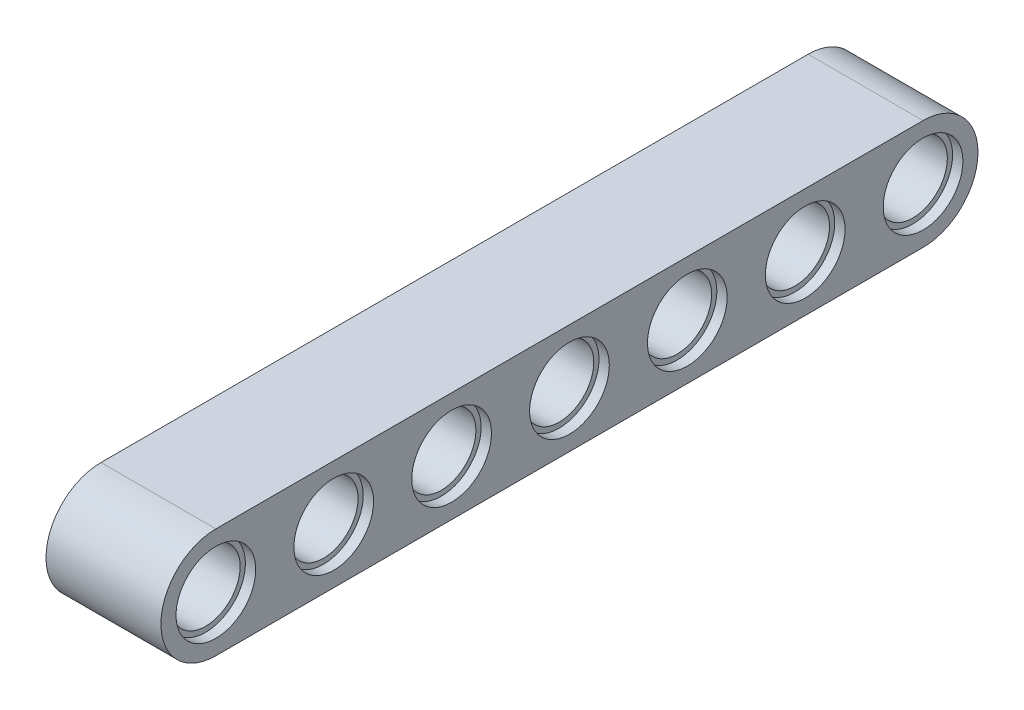
from build123d import *

# Parameters (mm, degrees)
SKETCH1_R           = 2.35
BOSS_EXTRUDE1_DEPTH = 7.8
SKETCH2_R           = 2.705
CUT_EXTRUDE2_DEPTH  = 0.7
CUT_EXTRUDE3_START  = -0.7
SKETCH3_R           = 2.705
CUT_EXTRUDE3_DEPTH  = 0.7


with BuildPart() as part:
    # Sketch1 → Boss-Extrude1 (new body)
    with BuildSketch(Plane(origin=(0, 0, 0), x_dir=(0, 0, -1), z_dir=(1, 0, 0))):
        with BuildLine():
            Line((-24, -3.73), (24, -3.73))
            ThreePointArc((24, -3.73), (27.73, 0), (24, 3.73))
            Line((24, 3.73), (-24, 3.73))
            ThreePointArc((-24, 3.73), (-27.73, 0), (-24, -3.73))
        make_face()
        with Locations((-24, 0)):
            Circle(SKETCH1_R, mode=Mode.SUBTRACT)
        with Locations((-16, 0)):
            Circle(SKETCH1_R, mode=Mode.SUBTRACT)
        with Locations((-8, 0)):
            Circle(SKETCH1_R, mode=Mode.SUBTRACT)
        Circle(SKETCH1_R, mode=Mode.SUBTRACT)
        with Locations((8, 0)):
            Circle(SKETCH1_R, mode=Mode.SUBTRACT)
        with Locations((16, 0)):
            Circle(SKETCH1_R, mode=Mode.SUBTRACT)
        with Locations((24, 0)):
            Circle(SKETCH1_R, mode=Mode.SUBTRACT)
    extrude(amount=BOSS_EXTRUDE1_DEPTH)

    # Sketch2 → Cut-Extrude2 (cut)
    with BuildSketch(Plane.ZY):
        with Locations((-24, 0)):
            Circle(SKETCH2_R)
        with Locations((-16, 0)):
            Circle(SKETCH2_R)
        with Locations((-8, 0)):
            Circle(SKETCH2_R)
        Circle(SKETCH2_R)
        with Locations((8, 0)):
            Circle(SKETCH2_R)
        with Locations((16, 0)):
            Circle(SKETCH2_R)
        with Locations((24, 0)):
            Circle(SKETCH2_R)
    extrude(amount=-CUT_EXTRUDE2_DEPTH, mode=Mode.SUBTRACT)

    # Sketch3 → Cut-Extrude3 (cut)
    with BuildSketch(Plane(origin=(7.8, 0, 0), x_dir=(0, 0, -1), z_dir=(1, 0, 0)).offset(CUT_EXTRUDE3_START)):
        with Locations((-24, 0)):
            Circle(SKETCH3_R)
        with Locations((-16, 0)):
            Circle(SKETCH3_R)
        with Locations((-8, 0)):
            Circle(SKETCH3_R)
        Circle(SKETCH3_R)
        with Locations((8, 0)):
            Circle(SKETCH3_R)
        with Locations((16, 0)):
            Circle(SKETCH3_R)
        with Locations((24, 0)):
            Circle(SKETCH3_R)
    extrude(amount=CUT_EXTRUDE3_DEPTH, mode=Mode.SUBTRACT)


solid = part.part
